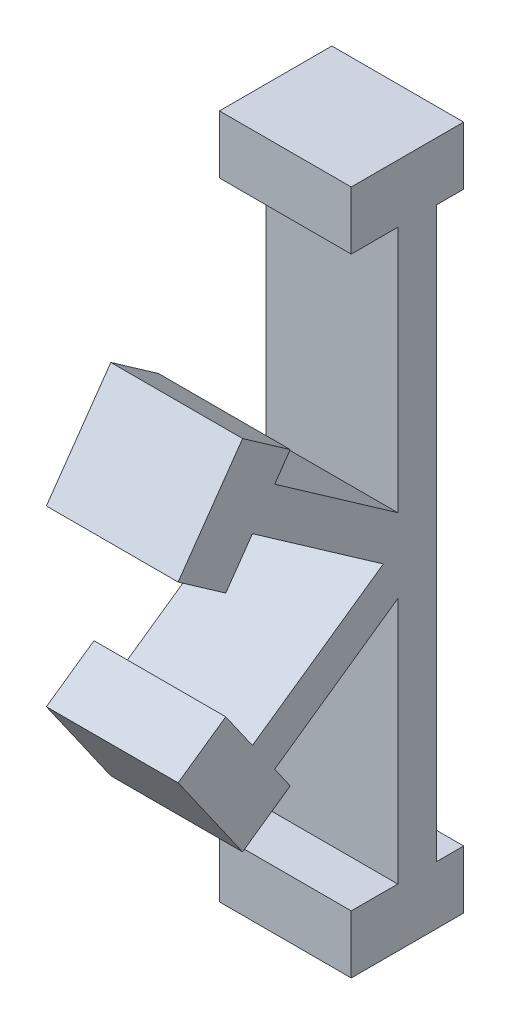
from build123d import *

# Parameters (mm, degrees)
SKETCH2_W           = 147.5
SKETCH2_H           = 176.75
BOSS_EXTRUDE1_DEPTH = 10
SKETCH3_W           = 29
SKETCH3_H           = 15
BOSS_EXTRUDE2_DEPTH = 34
BOSS_EXTRUDE3_DEPTH = 34
SKETCH8_W           = 113.5
SKETCH8_H           = 176.75
CUT_EXTRUDE1_DEPTH  = 30


with BuildPart() as part:
    # Sketch2 → Boss-Extrude1 (new body)
    with BuildSketch(Plane.XY):
        Rectangle(SKETCH2_W, SKETCH2_H)
    extrude(amount=BOSS_EXTRUDE1_DEPTH)

    # Sketch3 → Boss-Extrude2 (add)
    with BuildSketch(Plane.ZY.offset(73.75)):
        with Locations((7.5, 80.875)):
            Rectangle(SKETCH3_W, SKETCH3_H)
        with Locations((7.5, -80.875)):
            Rectangle(SKETCH3_W, SKETCH3_H)
    boss_extrude2 = extrude(amount=-BOSS_EXTRUDE2_DEPTH)

    # Mirror1: Boss-Extrude2 across plane
    add(boss_extrude2.mirror(Plane(origin=(0, 0, 0), x_dir=(0, 0, 1), z_dir=(1, 0, 0))))

    # Sketch5 → Boss-Extrude3 (add)
    with BuildSketch(Plane.ZY.offset(73.75)):
        Polygon((10, -9.604910635), (41.758597961, -31.84252033), (37.743562906, -37.57658464), (50.030843571, -46.180231185), (66.664560225, -22.424821901), (54.37727956, -13.821175356), (47.494362324, -23.650999887), (13.717233978, 0), (47.494362324, 23.650999887), (54.37727956, 13.821175356), (66.664560225, 22.424821901), (50.030843571, 46.180231185), (37.743562906, 37.57658464), (41.758597961, 31.84252033), (10, 9.604910635), align=None)
    extrude(amount=-BOSS_EXTRUDE3_DEPTH)

    # Sketch8 → Cut-Extrude1 (cut)
    with BuildSketch(Plane.XY.offset(22)):
        with Locations((17, 0)):
            Rectangle(SKETCH8_W, SKETCH8_H)
    extrude(amount=-CUT_EXTRUDE1_DEPTH, mode=Mode.SUBTRACT)


solid = part.part
